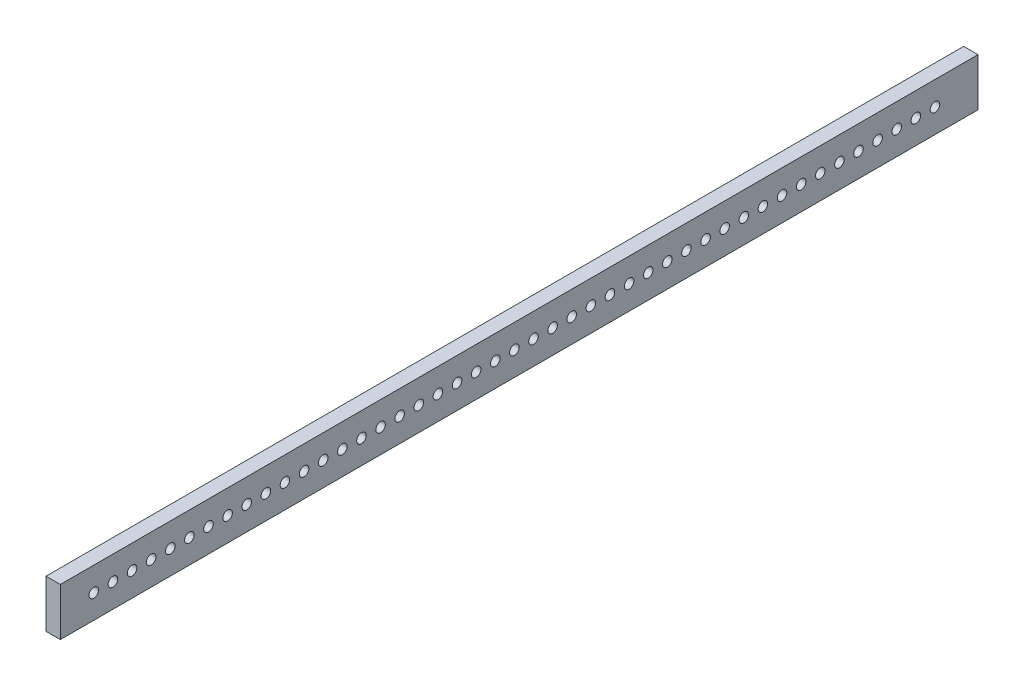
from build123d import *

# Parameters (mm, degrees)
SKETCH1_W           = 960
SKETCH1_H           = 50
SKETCH1_R           = 5
BOSS_EXTRUDE1_DEPTH = 15
SKETCH3_R           = 5
CUT_EXTRUDE2_DEPTH  = 481.884601542


with BuildPart() as part:
    # Sketch1 → Boss-Extrude1 (new body)
    with BuildSketch(Plane(origin=(0, 0, 0), x_dir=(0, 0, -1), z_dir=(1, 0, 0))):
        Rectangle(SKETCH1_W, SKETCH1_H)
        with Locations((-205, 0)):
            Circle(SKETCH1_R, mode=Mode.SUBTRACT)
        with Locations((-185, 0)):
            Circle(SKETCH1_R, mode=Mode.SUBTRACT)
        with Locations((-165, 0)):
            Circle(SKETCH1_R, mode=Mode.SUBTRACT)
        with Locations((-145, 0)):
            Circle(SKETCH1_R, mode=Mode.SUBTRACT)
        with Locations((-125, 0)):
            Circle(SKETCH1_R, mode=Mode.SUBTRACT)
        with Locations((-105, 0)):
            Circle(SKETCH1_R, mode=Mode.SUBTRACT)
        with Locations((-85, 0)):
            Circle(SKETCH1_R, mode=Mode.SUBTRACT)
        with Locations((-65, 0)):
            Circle(SKETCH1_R, mode=Mode.SUBTRACT)
        with Locations((-45, 0)):
            Circle(SKETCH1_R, mode=Mode.SUBTRACT)
        with Locations((-25, 0)):
            Circle(SKETCH1_R, mode=Mode.SUBTRACT)
        with Locations((-5, 0)):
            Circle(SKETCH1_R, mode=Mode.SUBTRACT)
        with Locations((15, 0)):
            Circle(SKETCH1_R, mode=Mode.SUBTRACT)
        with Locations((35, 0)):
            Circle(SKETCH1_R, mode=Mode.SUBTRACT)
        with Locations((55, 0)):
            Circle(SKETCH1_R, mode=Mode.SUBTRACT)
        with Locations((75, 0)):
            Circle(SKETCH1_R, mode=Mode.SUBTRACT)
        with Locations((95, 0)):
            Circle(SKETCH1_R, mode=Mode.SUBTRACT)
        with Locations((115, 0)):
            Circle(SKETCH1_R, mode=Mode.SUBTRACT)
        with Locations((135, 0)):
            Circle(SKETCH1_R, mode=Mode.SUBTRACT)
        with Locations((155, 0)):
            Circle(SKETCH1_R, mode=Mode.SUBTRACT)
        with Locations((175, 0)):
            Circle(SKETCH1_R, mode=Mode.SUBTRACT)
        with Locations((195, 0)):
            Circle(SKETCH1_R, mode=Mode.SUBTRACT)
        with Locations((215, 0)):
            Circle(SKETCH1_R, mode=Mode.SUBTRACT)
        with Locations((235, 0)):
            Circle(SKETCH1_R, mode=Mode.SUBTRACT)
        with Locations((255, 0)):
            Circle(SKETCH1_R, mode=Mode.SUBTRACT)
        with Locations((275, 0)):
            Circle(SKETCH1_R, mode=Mode.SUBTRACT)
    extrude(amount=BOSS_EXTRUDE1_DEPTH)

    # Sketch3 → Cut-Extrude2 (cut, through all)
    with BuildSketch(Plane.ZY):
        with Locations((-295, 0)):
            Circle(SKETCH3_R)
        with Locations((-315, 0)):
            Circle(SKETCH3_R)
        with Locations((-335, 0)):
            Circle(SKETCH3_R)
        with Locations((-355, 0)):
            Circle(SKETCH3_R)
        with Locations((-375, 0)):
            Circle(SKETCH3_R)
        with Locations((-395, 0)):
            Circle(SKETCH3_R)
        with Locations((-415, 0)):
            Circle(SKETCH3_R)
        with Locations((-435, 0)):
            Circle(SKETCH3_R)
        with Locations((225, 0)):
            Circle(SKETCH3_R)
        with Locations((245, 0)):
            Circle(SKETCH3_R)
        with Locations((265, 0)):
            Circle(SKETCH3_R)
        with Locations((285, 0)):
            Circle(SKETCH3_R)
        with Locations((305, 0)):
            Circle(SKETCH3_R)
        with Locations((325, 0)):
            Circle(SKETCH3_R)
        with Locations((345, 0)):
            Circle(SKETCH3_R)
        with Locations((365, 0)):
            Circle(SKETCH3_R)
        with Locations((385, 0)):
            Circle(SKETCH3_R)
        with Locations((405, 0)):
            Circle(SKETCH3_R)
        with Locations((425, 0)):
            Circle(SKETCH3_R)
        with Locations((445, 0)):
            Circle(SKETCH3_R)
    extrude(amount=-CUT_EXTRUDE2_DEPTH, mode=Mode.SUBTRACT)


solid = part.part
